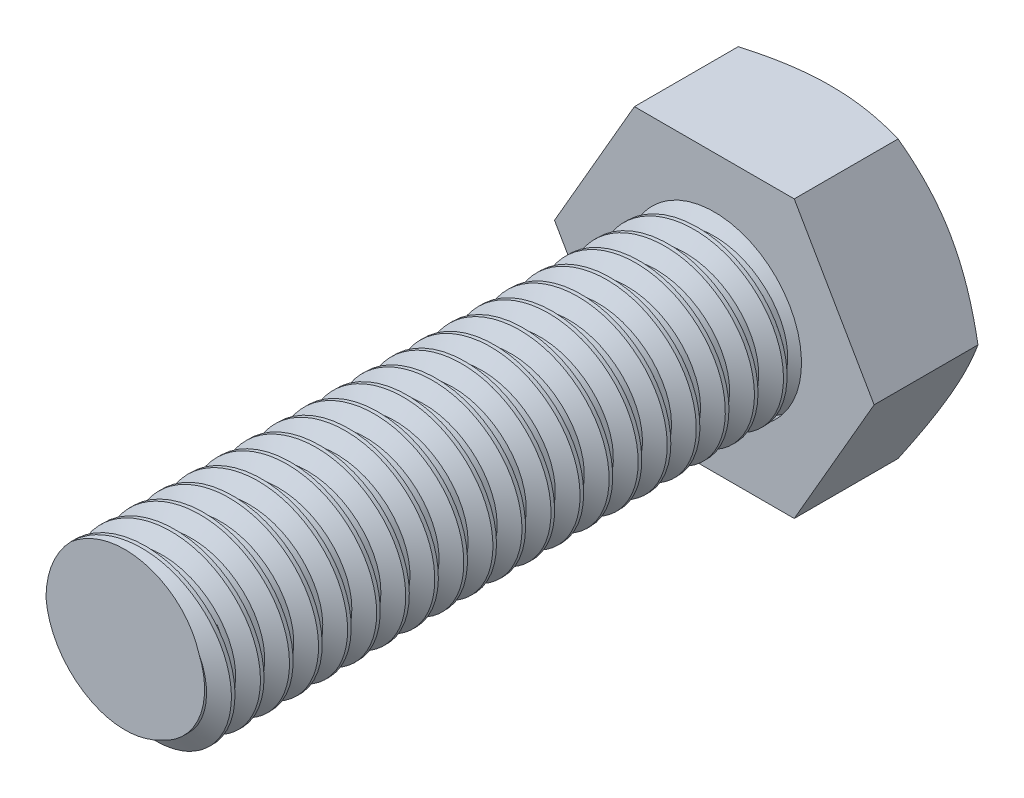
from build123d import *

# Parameters (mm, degrees)
BOSS_EXTRUDE1_DEPTH      = 1
BOSS_EXTRUDE1_DEPTH_BACK = 1
SKETCH2_R                = 1.5
BOSS_EXTRUDE2_DEPTH      = 10
THREAD1_PITCH            = 0.5
SKETCH24_OUTSIDE_W       = 12.904
SKETCH24_OUTSIDE_H       = 12.168
SKETCH24_OUTSIDE_R       = 2.38156986
CUT_EXTRUDE3_DEPTH       = 0.75
CUT_EXTRUDE3_DRAFT       = -60


with BuildPart() as part:
    # Sketch1 → Boss-Extrude1 (new, two sides: drawn at the far end of the back side and taken through both)
    with BuildSketch(Plane.XY.offset(-BOSS_EXTRUDE1_DEPTH_BACK)):
        Polygon((1.375, 2.38156986), (-1.375, 2.38156986), (-2.75, 0), (-1.375, -2.38156986), (1.375, -2.38156986), (2.75, 0), align=None)
    extrude(amount=BOSS_EXTRUDE1_DEPTH + BOSS_EXTRUDE1_DEPTH_BACK)

    # Sketch2 → Boss-Extrude2 (add)
    with BuildSketch(Plane.XY.offset(1)):
        Circle(SKETCH2_R)
    extrude(amount=BOSS_EXTRUDE2_DEPTH)

    # Thread1: the profile of Thread Profile1 profile screwed along a right-hand helix of 22 turns, 6 arcs to a turn; built about Z, then put on its axis
    thread1_z = Axis((0, 0, 0), (0, 0, 1))
    thread1_corners = [(1.5003, 0, -0.000173205), (1.5003, 0, 0.437673204), (1.229367063, 0, 0.281249999), (1.229367063, 0, 0.156249999)]
    with BuildLine(mode=Mode.PRIVATE) as thread1_profile:
        Line(thread1_corners[0], thread1_corners[1])
        Line(thread1_corners[1], thread1_corners[2])
        Line(thread1_corners[2], thread1_corners[3])
        Line(thread1_corners[3], thread1_corners[0])
    thread1_cap = Face(thread1_profile.wire())
    thread1_turn_angles = [0, 30, 60, 90, 120, 150, 180, 210, 240, 270, 300, 330, 360]
    thread1_turn_weights = [1, 0.8660254037844387, 1, 0.8660254037844387, 1, 0.8660254037844387, 1, 0.8660254037844387, 1, 0.8660254037844387, 1, 0.8660254037844387, 1]
    thread1_turn_rails = [Edge.make_bspline([Vector(p[0], p[1], 0).rotate(thread1_z, thread1_turn_angles[k]) / thread1_turn_weights[k] + Vector(0, 0, p[2] + THREAD1_PITCH * thread1_turn_angles[k] / 360) for k in range(13)], [0, 0, 0, 1, 1, 2, 2, 3, 3, 4, 4, 5, 5, 6, 6, 6], 2, thread1_turn_weights) for p in thread1_corners]
    thread1_turn_sides = [Face.make_surface_from_curves(thread1_turn_rails[p[0]], thread1_turn_rails[p[1]]) for p in [(0, 1), (1, 2), (2, 3), (3, 0)]]
    thread1 = Plane(origin=(0, 0, 12), x_dir=(-1, 0, 0), z_dir=(0, 0, -1)) * Solid(Shell([*[p.moved(Location((0, 0, THREAD1_PITCH * i))) for i in range(22) for p in thread1_turn_sides], thread1_cap, thread1_cap.rotate(thread1_z, 7920).moved(Location((0, 0, THREAD1_PITCH * 7920 / 360)))]))
    add(thread1, mode=Mode.SUBTRACT)


with BuildPart() as cut_extrude3_tool:
    # Sketch24 outside → Cut-Extrude3 (with draft: the straight prism first)
    with BuildSketch(Plane(origin=(0, 0, -1), x_dir=(-1, 0, 0), z_dir=(0, 0, -1))):
        Rectangle(SKETCH24_OUTSIDE_W, SKETCH24_OUTSIDE_H)
        Circle(SKETCH24_OUTSIDE_R, mode=Mode.SUBTRACT)
    extrude(amount=-CUT_EXTRUDE3_DEPTH)
    # Cut-Extrude3: the draft: its side faces are tilted about the plane it starts from
    cut_extrude3_sides = [cut_extrude3_tool.faces().sort_by_distance(p)[0] for p in [
        (0, -6.084, -0.625),
        (-6.452, 0, -0.625),
        (0, 6.084, -0.625),
        (6.452, 0, -0.625),
        (2.38156986, 0, -0.625),
    ]]
    draft(cut_extrude3_sides, Plane(origin=(0, 0, -1), x_dir=(-1, 0, 0), z_dir=(0, 0, -1)), CUT_EXTRUDE3_DRAFT)


with BuildPart() as part_1:
    add(part.part)

    # Cut-Extrude3: cut by cut_extrude3_tool
    add(cut_extrude3_tool.part, mode=Mode.SUBTRACT)


solid = part_1.part
